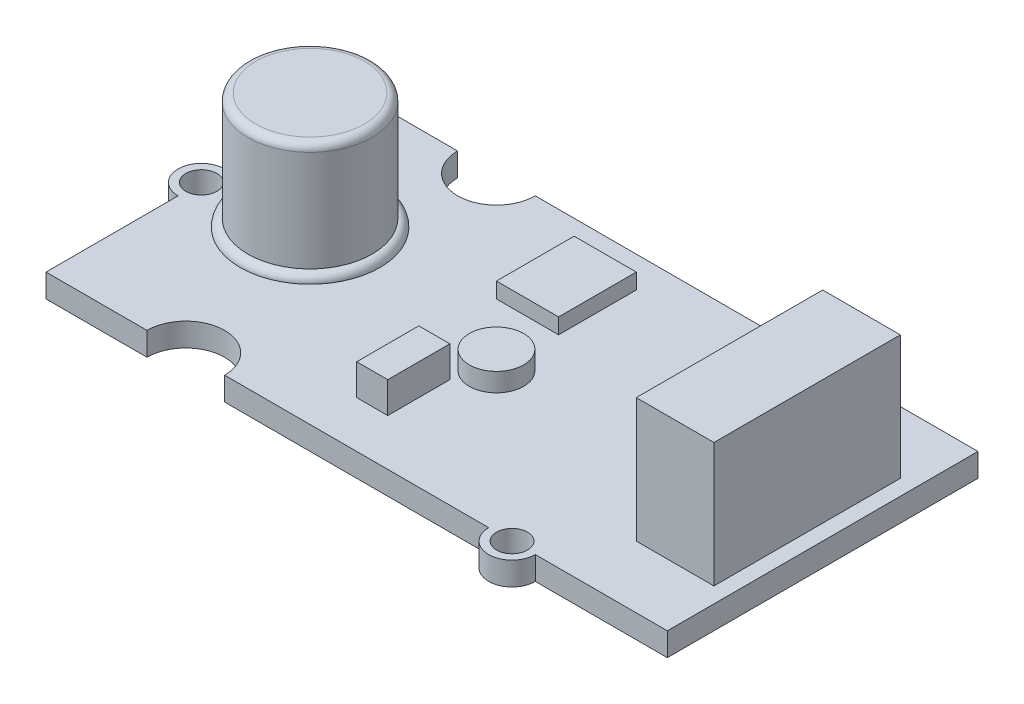
from build123d import *

# Parameters (mm, degrees)
SKETCH1_W                        = 40
SKETCH1_H                        = 20
PCB_DEPTH                        = 1.5
SKETCH3_R                        = 1.5
TOP_MOUNTING_HOLE_DEPTH          = 1.5
SKETCH4_R                        = 1
TOP_MOUNTING_HOLE_2_DEPTH        = 1.5
SKETCH5_R                        = 2.5
SIDE_INLETS_DEPTH                = 1.5
SKETCH6_R                        = 1.5
SIDE_MOUNTING_HOLE_OUTLINE_DEPTH = 1.5
SKETCH7_R                        = 1
SIDE_MOUNTING_HOLES_DEPTH        = 1.5
SKETCH8_R                        = 4.5
SENSOR_BASE_DEPTH                = 0.5
SKETCH9_R                        = 4
SENSOR_DEPTH                     = 7
SENSOR_FILLET_R                  = 0.5
SKETCH10_W                       = 5
SKETCH10_H                       = 12
CONNECTOR_DEPTH                  = 8
SKETCH11_W                       = 4
SKETCH11_H                       = 5
CHIP_DEPTH                       = 1
SKETCH12_R                       = 1.75
BOSS_EXTRUDE10_DEPTH             = 1.2
SKETCH13_W                       = 2
SKETCH13_H                       = 4
BOSS_EXTRUDE11_DEPTH             = 2


with BuildPart() as part:
    # Sketch1 → PCB (new body)
    with BuildSketch(Plane(origin=(0, 0, 0), x_dir=(1, 0, 0), z_dir=(0, 1, 0))):
        Rectangle(SKETCH1_W, SKETCH1_H)
    extrude(amount=PCB_DEPTH)

    # Sketch3 → Top mounting hole (add)
    with BuildSketch(Plane.XZ):
        with Locations((-20, 0)):
            Circle(SKETCH3_R)
    extrude(amount=-TOP_MOUNTING_HOLE_DEPTH)

    # Sketch4 → Top mounting hole 2 (cut)
    with BuildSketch(Plane.XZ):
        with Locations(Location((-20, 0, 0), (0, 0, 270))):
            Circle(SKETCH4_R)
    extrude(amount=-TOP_MOUNTING_HOLE_2_DEPTH, mode=Mode.SUBTRACT)

    # Sketch5 → Side inlets (cut)
    with BuildSketch(Plane.XZ):
        with Locations((-11, -10)):
            Circle(SKETCH5_R)
        with Locations((-11, 10)):
            Circle(SKETCH5_R)
    extrude(amount=-SIDE_INLETS_DEPTH, mode=Mode.SUBTRACT)

    # Sketch6 → side mounting hole outline (add)
    with BuildSketch(Plane(origin=(0, 1.5, 0), x_dir=(1, 0, 0), z_dir=(0, 1, 0))):
        with Locations((10, 10)):
            Circle(SKETCH6_R)
        with Locations((10, -10)):
            Circle(SKETCH6_R)
    extrude(amount=-SIDE_MOUNTING_HOLE_OUTLINE_DEPTH)

    # Sketch7 → side mounting holes (cut)
    with BuildSketch(Plane(origin=(0, 1.5, 0), x_dir=(1, 0, 0), z_dir=(0, 1, 0))):
        with Locations(Location((10, 10, 0), (0, 0, 270))):
            Circle(SKETCH7_R)
        with Locations(Location((10, -10, 0), (0, 0, 270))):
            Circle(SKETCH7_R)
    extrude(amount=-SIDE_MOUNTING_HOLES_DEPTH, mode=Mode.SUBTRACT)

    # Sketch8 → sensor base (add)
    with BuildSketch(Plane(origin=(0, 1.5, 0), x_dir=(1, 0, 0), z_dir=(0, 1, 0))):
        with Locations(Location((-14, 1, 0), (0, 0, 270))):
            Circle(SKETCH8_R)
    extrude(amount=SENSOR_BASE_DEPTH)

    # Sketch9 → sensor (add)
    with BuildSketch(Plane(origin=(0, 2, 0), x_dir=(1, 0, 0), z_dir=(0, 1, 0))):
        with Locations(Location((-14, 1, 0), (0, 0, 270))):
            Circle(SKETCH9_R)
    extrude(amount=SENSOR_DEPTH)

    # sensor fillet
    sensor_fillet_edges = [part.edges().sort_by_distance(p)[0] for p in [
        (-14, 2, -5.5),
        (-14, 9, -5),
    ]]
    fillet(sensor_fillet_edges, radius=SENSOR_FILLET_R - 0.0001)  # a hair under: the kernel refuses the full size

    # Sketch10 → connector (add)
    with BuildSketch(Plane(origin=(0, 1.5, 0), x_dir=(1, 0, 0), z_dir=(0, 1, 0))):
        with Locations((16.5, 0)):
            Rectangle(SKETCH10_W, SKETCH10_H)
    extrude(amount=CONNECTOR_DEPTH)

    # Sketch11 → chip (add)
    with BuildSketch(Plane(origin=(0, 1.5, 0), x_dir=(1, 0, 0), z_dir=(0, 1, 0))):
        with Locations((-2, 5.5)):
            Rectangle(SKETCH11_W, SKETCH11_H)
    extrude(amount=CHIP_DEPTH)

    # Sketch12 → Boss-Extrude10 (add)
    with BuildSketch(Plane(origin=(0, 1.5, 0), x_dir=(1, 0, 0), z_dir=(0, 1, 0))):
        with Locations(Location((0, -1, 0), (0, 0, 270))):
            Circle(SKETCH12_R)
    extrude(amount=BOSS_EXTRUDE10_DEPTH)

    # Sketch13 → Boss-Extrude11 (add)
    with BuildSketch(Plane(origin=(0, 1.5, 0), x_dir=(1, 0, 0), z_dir=(0, 1, 0))):
        with Locations((-2, -5)):
            Rectangle(SKETCH13_W, SKETCH13_H)
    extrude(amount=BOSS_EXTRUDE11_DEPTH)


solid = part.part
